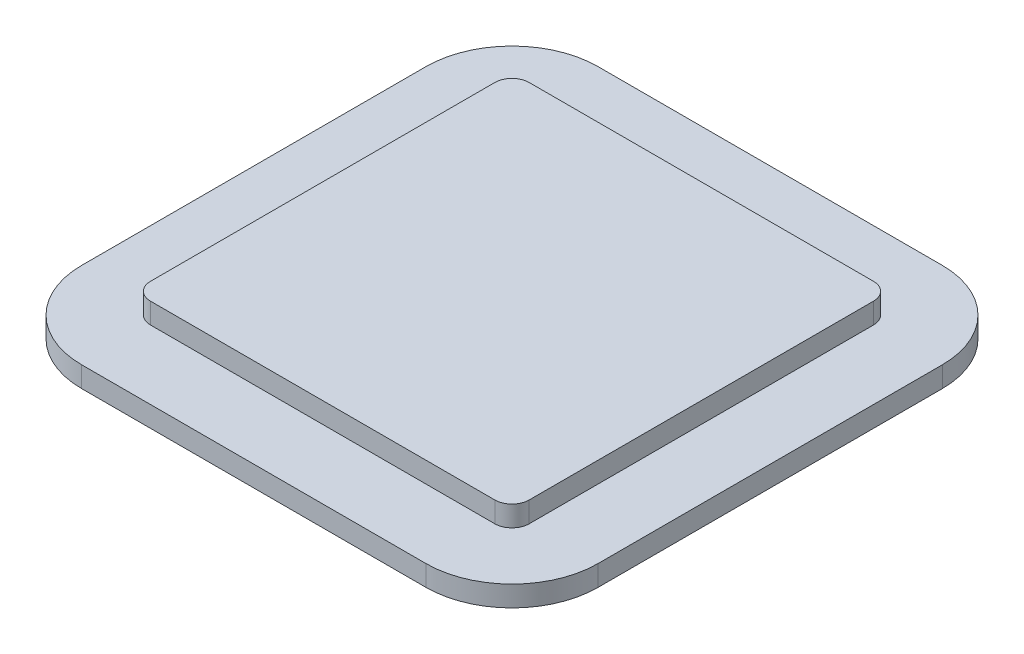
from build123d import *

# Parameters (mm, degrees)
SKETCH_1_W      = 15
SKETCH_1_H      = 15
EXTRUDE_1_DEPTH = 0.6
FILLET_1_R      = 2.5
SKETCH_2_W      = 11
SKETCH_2_H      = 11
EXTRUDE_2_DEPTH = 0.6
FILLET_2_R      = 0.5


with BuildPart() as part:
    # 草图1 → 凸台-拉伸1 (new body)
    with BuildSketch(Plane(origin=(0, 0, 0), x_dir=(1, 0, 0), z_dir=(0, 1, 0))):
        with Locations((53.495024876, 28.718905473)):
            Rectangle(SKETCH_1_W, SKETCH_1_H)
    extrude(amount=EXTRUDE_1_DEPTH)

    # 圆角1
    fillet_1_edges = [part.edges().sort_by_distance(p)[0] for p in [
        (60.995024876, 0.3, -36.218905473),
        (45.995024876, 0.3, -36.218905473),
        (60.995024876, 0.3, -21.218905473),
        (45.995024876, 0.3, -21.218905473),
    ]]
    fillet(fillet_1_edges, radius=FILLET_1_R)

    # 草图2 → 凸台-拉伸2 (add)
    with BuildSketch(Plane(origin=(0, 0.6, 0), x_dir=(1, 0, 0), z_dir=(0, 1, 0))):
        with Locations((53.495024876, 28.718905473)):
            Rectangle(SKETCH_2_W, SKETCH_2_H)
    extrude(amount=EXTRUDE_2_DEPTH)

    # 圆角2
    fillet_2_edges = [part.edges().sort_by_distance(p)[0] for p in [
        (58.995024876, 0.9, -34.218905473),
        (47.995024876, 0.9, -34.218905473),
        (58.995024876, 0.9, -23.218905473),
        (47.995024876, 0.9, -23.218905473),
    ]]
    fillet(fillet_2_edges, radius=FILLET_2_R)


solid = part.part
